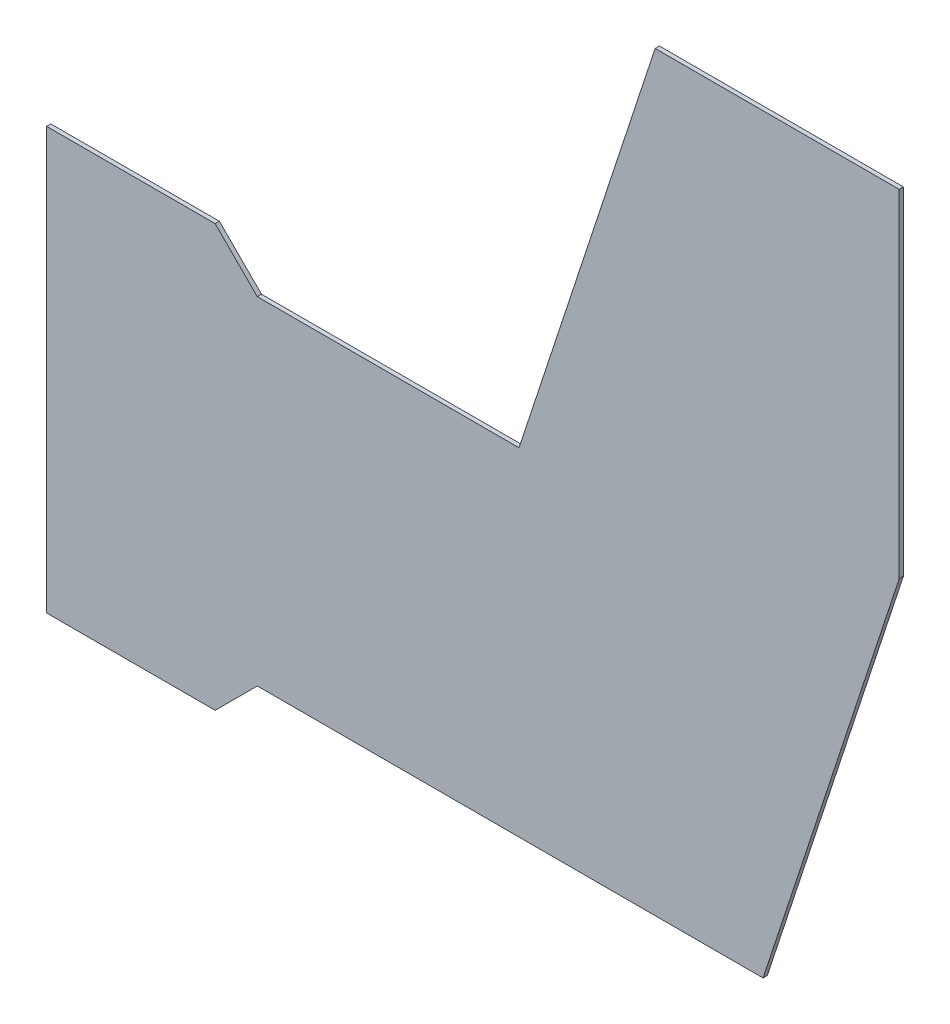
from build123d import *

# Parameters (mm, degrees)
BOSS_EXTRUDE1_DEPTH = 2.54


with BuildPart() as part:
    # Sketch1 → Boss-Extrude1 (new body)
    with BuildSketch(Plane.XY):
        Polygon((0, 0), (0, 254), (101.6, 254), (127, 228.6), (284.725894908, 228.6), (366.76607434, 478.028), (513.840179432, 478.028), (513.840179432, 274.828), (431.8, 25.4), (127, 25.4), (101.6, 0), align=None)
    extrude(amount=BOSS_EXTRUDE1_DEPTH)


solid = part.part
